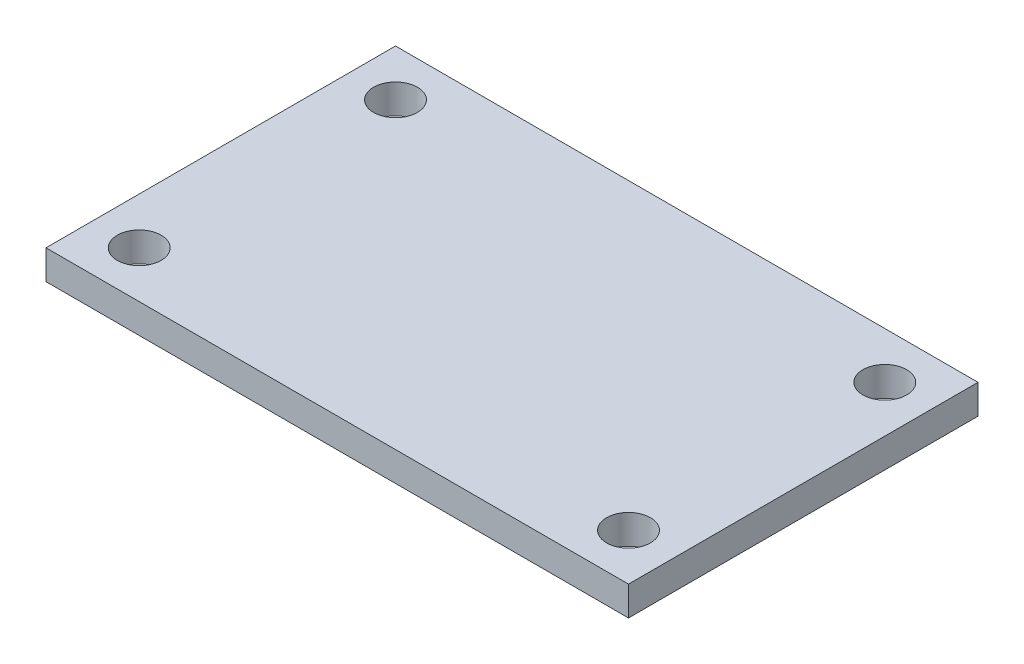
from build123d import *

# Parameters (mm, degrees)
SKETCH1_W           = 31.75
SKETCH1_H           = 19.05
SKETCH1_R           = 1.1938
BOSS_EXTRUDE1_DEPTH = 1.6


with BuildPart() as part:
    # Sketch1 → Boss-Extrude1 (new body)
    with BuildSketch(Plane(origin=(0, 0, 0), x_dir=(1, 0, 0), z_dir=(0, 1, 0))):
        Rectangle(SKETCH1_W, SKETCH1_H)
        with Locations((13.335, 6.985)):
            Circle(SKETCH1_R, mode=Mode.SUBTRACT)
        with Locations((13.335, -6.985)):
            Circle(SKETCH1_R, mode=Mode.SUBTRACT)
        with Locations((-13.335, -6.985)):
            Circle(SKETCH1_R, mode=Mode.SUBTRACT)
        with Locations((-13.335, 6.985)):
            Circle(SKETCH1_R, mode=Mode.SUBTRACT)
    extrude(amount=BOSS_EXTRUDE1_DEPTH)


solid = part.part
